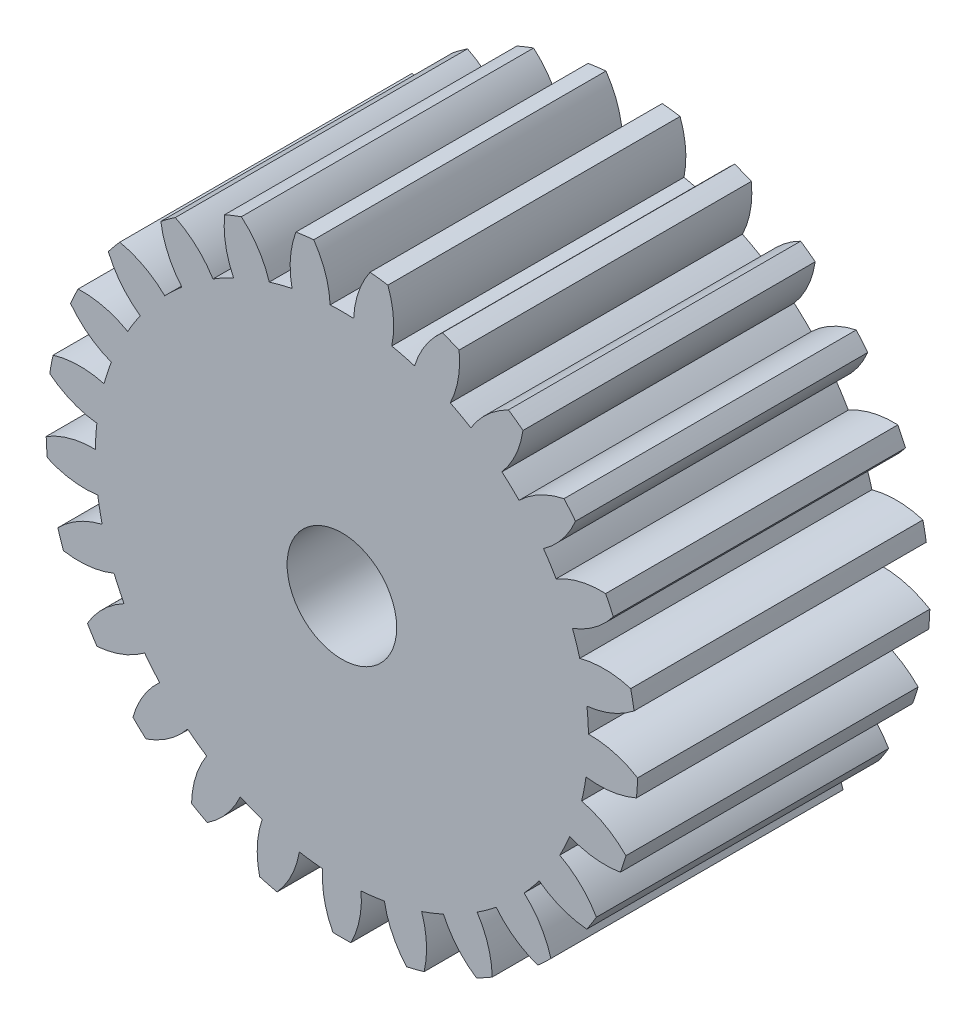
from build123d import *

# Parameters (mm, degrees)
SKETCH_1_R               = 8.1
SKETCH_1_R_2             = 1.5
EXTRUDE_1_DEPTH          = 4
CUT_EXTRUDE_1_DEPTH      = 13.133424908
PATTERN_CIRCULAR_1_COUNT = 25


with BuildPart() as part:
    # Эскиз1 → Бобышка-Вытянуть1 (new, symmetric)
    with BuildSketch(Plane.XY):
        Circle(SKETCH_1_R)
        Circle(SKETCH_1_R_2, mode=Mode.SUBTRACT)
    extrude(amount=EXTRUDE_1_DEPTH, both=True)

    # Эскиз2 → Вырез-Вытянуть1 (cut, symmetric)
    with BuildSketch(Plane.XY):
        with BuildLine():
            ThreePointArc((0.321606761, 6.742334098), (0, 6.75), (-0.321606761, 6.742334098))
            ThreePointArc((-0.321606761, 6.742334098), (-0.453066216, 7.434446009), (-0.770725573, 8.063248855))
            ThreePointArc((-0.770725573, 8.063248855), (0, 8.1), (0.770725573, 8.063248855))
            ThreePointArc((0.770725573, 8.063248855), (0.453066216, 7.434446009), (0.321606761, 6.742334098))
        make_face()
    cut_extrude_1 = extrude(amount=CUT_EXTRUDE_1_DEPTH, both=True, mode=Mode.SUBTRACT)

    # Круговой массив1: Вырез-Вытянуть1 ×25 about axis
    pattern_circular_1_axis = Axis((0, 0, 4), (0, 0, -1))
    for i in range(1, PATTERN_CIRCULAR_1_COUNT):
        add(cut_extrude_1.rotate(pattern_circular_1_axis, i * 360 / PATTERN_CIRCULAR_1_COUNT), mode=Mode.SUBTRACT)


solid = part.part
